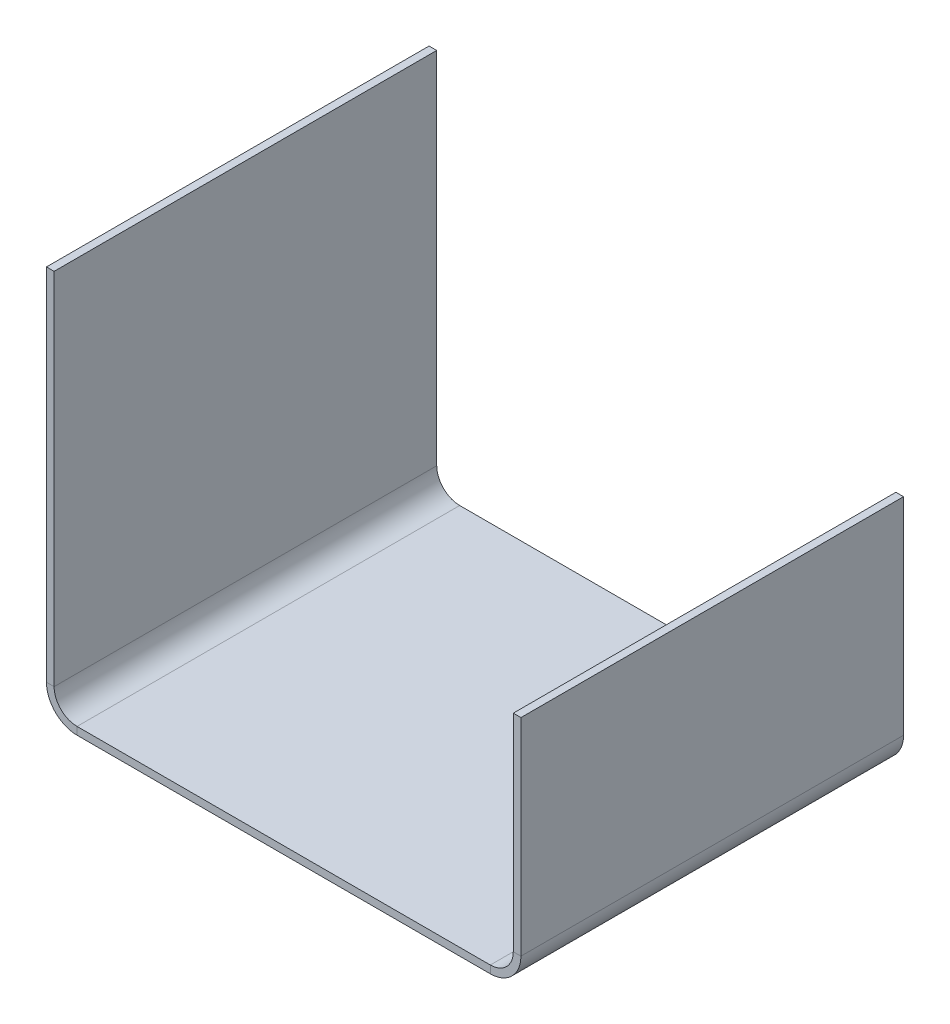
from build123d import *

# Parameters (mm, degrees)
BRIDA_BASE2_DEPTH = 100


# Sheet-metal steps are written as plain solids
with BuildPart() as part:
    # Croquis6 → Brida base2 (new body)
    with BuildSketch(Plane.XY):
        with BuildLine():
            Line((-60, 100), (-60, 6))
            ThreePointArc((-60, 6), (-58.242640687, 1.757359313), (-54, 0))
            Line((-54, 0), (54, 0))
            ThreePointArc((54, 0), (58.242640687, 1.757359313), (60, 6))
            Line((60, 6), (60, 60))
            Line((60, 60), (62, 60))
            Line((62, 60), (62, 6))
            ThreePointArc((62, 6), (59.656854249, 0.343145751), (54, -2))
            Line((54, -2), (-54, -2))
            ThreePointArc((-54, -2), (-59.656854249, 0.343145751), (-62, 6))
            Line((-62, 6), (-62, 100))
            Line((-62, 100), (-60, 100))
        make_face()
    extrude(amount=BRIDA_BASE2_DEPTH)


solid = part.part
